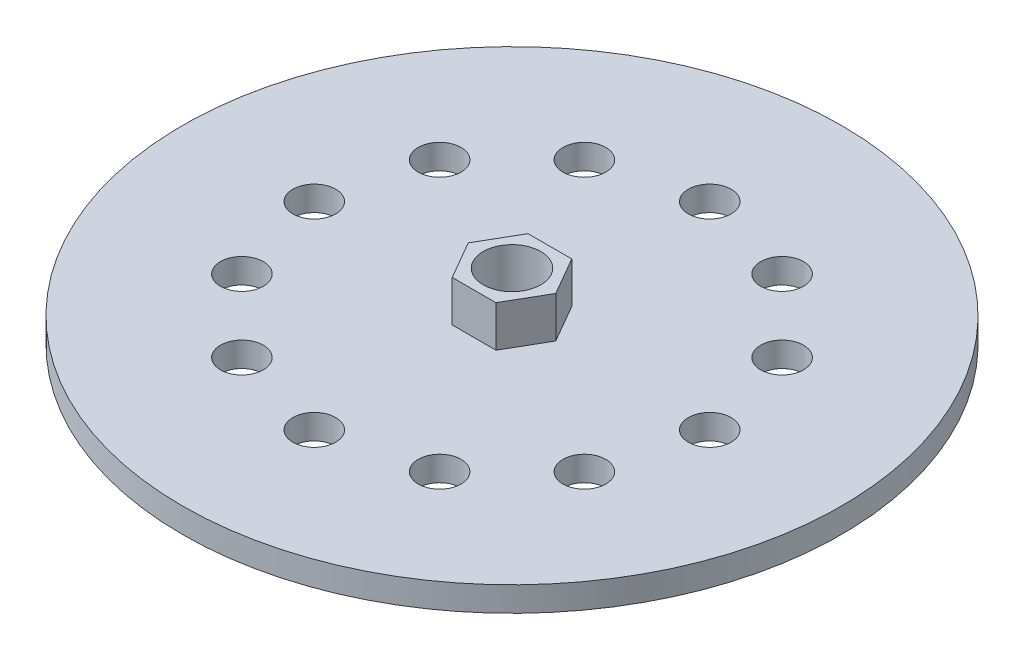
from build123d import *

# Parameters (mm, degrees)
SKETCH1_R           = 50.8
BOSS_EXTRUDE1_DEPTH = 3.81
SKETCH4_R           = 4.445
BOSS_EXTRUDE2_DEPTH = 6.35
SKETCH5_R           = 3.302
CUT_EXTRUDE1_DEPTH  = 73.122135992


with BuildPart() as part:
    # Sketch1 → Boss-Extrude1 (new body)
    with BuildSketch(Plane(origin=(0, 0, 0), x_dir=(1, 0, 0), z_dir=(0, 1, 0))):
        Circle(SKETCH1_R)
    extrude(amount=BOSS_EXTRUDE1_DEPTH)

    # Sketch4 → Boss-Extrude2 (add)
    with BuildSketch(Plane(origin=(0, 3.81, 0), x_dir=(1, 0, 0), z_dir=(0, 1, 0))):
        Polygon((3.372880273, 5.842), (-3.372880273, 5.842), (-6.745760545, 0), (-3.372880273, -5.842), (3.372880273, -5.842), (6.745760545, 0), align=None)
        Circle(SKETCH4_R, mode=Mode.SUBTRACT)
    extrude(amount=BOSS_EXTRUDE2_DEPTH)

    # Sketch5 → Cut-Extrude1 (cut, through all)
    with BuildSketch(Plane(origin=(0, 3.81, 0), x_dir=(1, 0, 0), z_dir=(0, 1, 0))):
        with Locations((0, 30.48)):
            Circle(SKETCH5_R)
        with Locations((15.24, 26.396454307)):
            Circle(SKETCH5_R)
        with Locations((26.396454307, 15.24)):
            Circle(SKETCH5_R)
        with Locations((30.48, 0)):
            Circle(SKETCH5_R)
        with Locations((26.396454307, -15.24)):
            Circle(SKETCH5_R)
        with Locations((15.24, -26.396454307)):
            Circle(SKETCH5_R)
        with Locations((0, -30.48)):
            Circle(SKETCH5_R)
        with Locations((-15.24, -26.396454307)):
            Circle(SKETCH5_R)
        with Locations((-26.396454307, -15.24)):
            Circle(SKETCH5_R)
        with Locations((-30.48, 0)):
            Circle(SKETCH5_R)
        with Locations((-26.396454307, 15.24)):
            Circle(SKETCH5_R)
        with Locations((-15.24, 26.396454307)):
            Circle(SKETCH5_R)
    extrude(amount=-CUT_EXTRUDE1_DEPTH, mode=Mode.SUBTRACT)


solid = part.part
